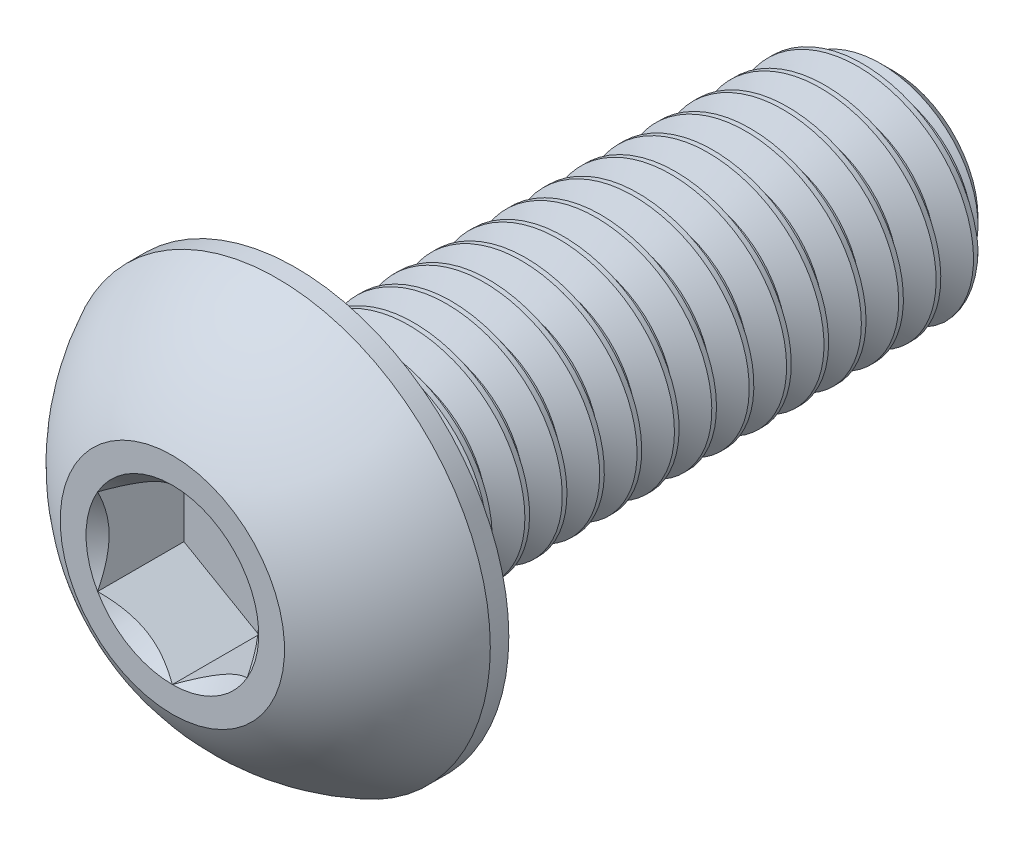
from build123d import *

# Parameters (mm, degrees)
SKETCH1_W          = 8
SKETCH1_H          = 1.5
CHAMFER1_SIZE      = 0.375
CUT_SWEEP1_PITCH   = 0.5
CUT_EXTRUDE2_DEPTH = 1.155


with BuildPart() as part:
    # Sketch1 → Revolve1 (revolve)
    with BuildSketch(Plane(origin=(0, 0, 0), x_dir=(0, 0, -1), z_dir=(1, 0, 0))):
        with Locations((5.65, 0.75)):
            Rectangle(SKETCH1_W, SKETCH1_H)
    revolve(axis=Axis((0, 0, -9.65), (0, 0, 1)))

    # Chamfer1
    chamfer1_edges = [part.edges().sort_by_distance(p)[0] for p in [
        (0, -1.5, -9.65),
    ]]
    chamfer(chamfer1_edges, length=CHAMFER1_SIZE)

    # Cut-Sweep1: the profile of Sketch2 profile screwed along a right-hand helix of 17 turns, 6 arcs to a turn; built about Z, then put on its axis
    cut_sweep1_z = Axis((0, 0, 0), (0, 0, 1))
    cut_sweep1_corners = [(1.5003, 0, 0.000173205), (1.5003, 0, -0.437673205), (1.175240474, 0, -0.25), (1.175240474, 0, -0.1875)]
    with BuildLine(mode=Mode.PRIVATE) as cut_sweep1_profile:
        Line(cut_sweep1_corners[0], cut_sweep1_corners[1])
        Line(cut_sweep1_corners[1], cut_sweep1_corners[2])
        Line(cut_sweep1_corners[2], cut_sweep1_corners[3])
        Line(cut_sweep1_corners[3], cut_sweep1_corners[0])
    cut_sweep1_cap = Face(cut_sweep1_profile.wire())
    cut_sweep1_turn_angles = [0, 30, 60, 90, 120, 150, 180, 210, 240, 270, 300, 330, 360]
    cut_sweep1_turn_weights = [1, 0.8660254037844387, 1, 0.8660254037844387, 1, 0.8660254037844387, 1, 0.8660254037844387, 1, 0.8660254037844387, 1, 0.8660254037844387, 1]
    cut_sweep1_turn_rails = [Edge.make_bspline([Vector(p[0], p[1], 0).rotate(cut_sweep1_z, cut_sweep1_turn_angles[k]) / cut_sweep1_turn_weights[k] + Vector(0, 0, p[2] + CUT_SWEEP1_PITCH * cut_sweep1_turn_angles[k] / 360) for k in range(13)], [0, 0, 0, 1, 1, 2, 2, 3, 3, 4, 4, 5, 5, 6, 6, 6], 2, cut_sweep1_turn_weights) for p in cut_sweep1_corners]
    cut_sweep1_turn_sides = [Face.make_surface_from_curves(cut_sweep1_turn_rails[p[0]], cut_sweep1_turn_rails[p[1]]) for p in [(0, 1), (1, 2), (2, 3), (3, 0)]]
    cut_sweep1 = Plane(origin=(0, 0, -9.65), x_dir=(0, 1, 0), z_dir=(0, 0, 1)) * Solid(Shell([*[p.moved(Location((0, 0, CUT_SWEEP1_PITCH * i))) for i in range(17) for p in cut_sweep1_turn_sides], cut_sweep1_cap, cut_sweep1_cap.rotate(cut_sweep1_z, 6120).moved(Location((0, 0, CUT_SWEEP1_PITCH * 6120 / 360)))]))
    add(cut_sweep1, mode=Mode.SUBTRACT)

    # Sketch7 → Revolve2 (revolve)
    with BuildSketch(Plane(origin=(0, 0, 0), x_dir=(0, 0, -1), z_dir=(1, 0, 0)), mode=Mode.PRIVATE) as revolve2_sk:
        with BuildLine():
            Line((1.4025, 2.85), (1.65, 2.85))
            Line((1.65, 2.85), (1.65, 0))
            Line((1.65, 0), (0, 0))
            Line((0, 0), (0, 1.5))
            ThreePointArc((0, 1.5), (0.59512511, 2.285251969), (1.4025, 2.85))
        make_face()
    revolve(revolve2_sk.sketch.rotate(Axis((0, 0, 0), (0, 0, -1)), 189.336081704), axis=Axis((0, 0, 0), (0, 0, -1)))

    # Sketch5 → Cut-Extrude2 (cut)
    with BuildSketch(Plane.XY):
        Polygon((1, -0.577350269), (1, 0.577350269), (0, 1.154700538), (-1, 0.577350269), (-1, -0.577350269), (0, -1.154700538), align=None)
    extrude(amount=-CUT_EXTRUDE2_DEPTH, mode=Mode.SUBTRACT)

    # Cut-Extrude3 cone 1 section (through the dimple's axis) → Cut-Extrude3 (revolve, cut)
    with BuildSketch(Plane(origin=(0, 0, 0), x_dir=(0, -1, 0), z_dir=(1, 0, 0))):
        Polygon((0, 0), (1.154700538, 0), (0, 1.154700538), align=None)
    revolve(axis=Axis((0, 0, 0), (0, 0, -1)), mode=Mode.SUBTRACT)


solid = part.part
